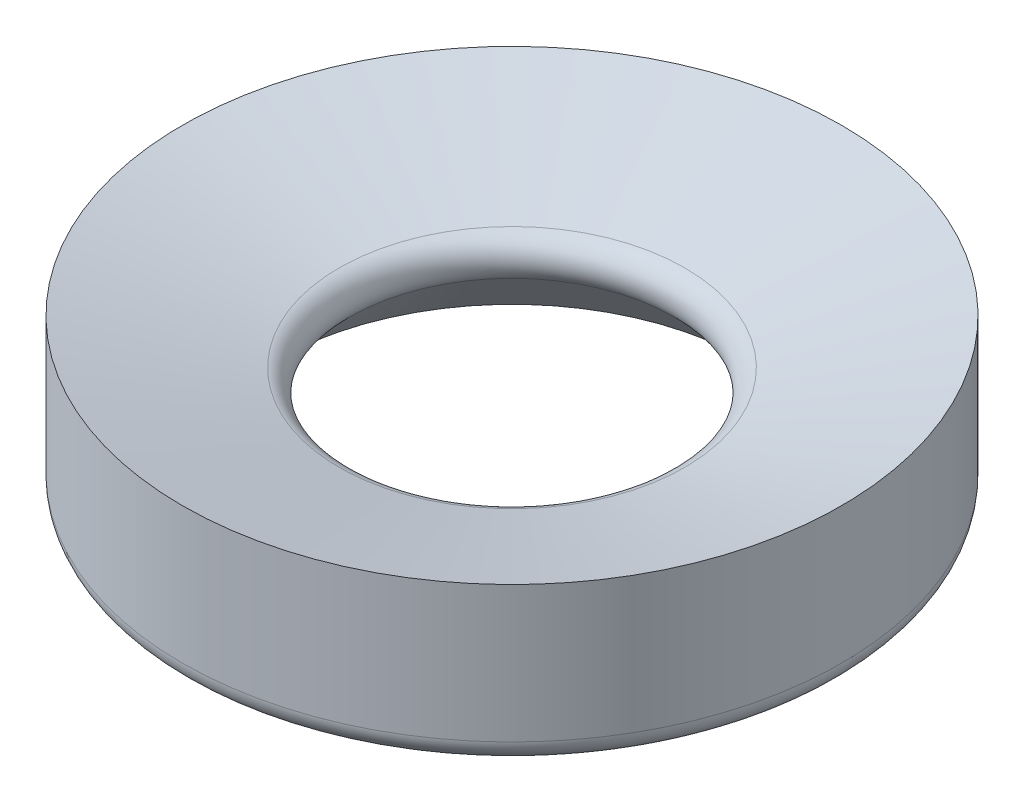
from build123d import *

# Parameters (mm, degrees)
SKETCH1_R           = 36.83
BOSS_EXTRUDE1_DEPTH = 17.78
FILLET1_R           = 2.54
SKETCH2_R           = 26.67
SKETCH3_R           = 14.7955
SKETCH4_R           = 14.7955
CUT_EXTRUDE1_DEPTH  = 76.2
SKETCH7_R           = 14.7955
SKETCH6_R           = 36.83
SKETCH8_R           = 31.75
SKETCH8_R_2         = 29.21
CUT_EXTRUDE2_DEPTH  = 2.54
FILLET3_R           = 2.54
FILLET4_R           = 2.54
FILLET5_R           = 2.54


with BuildPart() as part:
    # Sketch1 → Boss-Extrude1 (new body)
    with BuildSketch(Plane(origin=(0, 0, 0), x_dir=(1, 0, 0), z_dir=(0, 1, 0))):
        with Locations(Location((0, 0, 0), (0, 0, 90))):
            Circle(SKETCH1_R)
    extrude(amount=BOSS_EXTRUDE1_DEPTH)

    # Fillet1
    fillet1_edges = [part.edges().sort_by_distance(p)[0] for p in [
        (0, 0, 36.83),
    ]]
    fillet(fillet1_edges, radius=FILLET1_R)

    # Sketch2 → Cut-Loft1 section 0
    with BuildSketch(Plane(origin=(0, 0, 0), x_dir=(1, 0, 0), z_dir=(0, 1, 0))):
        Circle(SKETCH2_R)
    # Sketch3 → Cut-Loft1 section 1
    with BuildSketch(Plane(origin=(0, 11.938, 0), x_dir=(1, 0, 0), z_dir=(0, 1, 0))):
        Circle(SKETCH3_R)
    loft(mode=Mode.SUBTRACT)

    # Sketch4 → Cut-Extrude1 (cut)
    with BuildSketch(Plane.XZ.offset(-11.938)):
        with Locations(Location((0, 0, 0), (0, 0, 270))):
            Circle(SKETCH4_R)
    extrude(amount=-CUT_EXTRUDE1_DEPTH, mode=Mode.SUBTRACT)

    # Sketch7 → Cut-Loft2 section 0
    with BuildSketch(Plane(origin=(0, 11.43, 0), x_dir=(1, 0, 0), z_dir=(0, 1, 0))):
        Circle(SKETCH7_R)
    # Sketch6 → Cut-Loft2 section 1
    with BuildSketch(Plane(origin=(0, 17.78, 0), x_dir=(1, 0, 0), z_dir=(0, 1, 0))):
        Circle(SKETCH6_R)
    loft(mode=Mode.SUBTRACT)

    # Sketch8 → Cut-Extrude2 (cut)
    with BuildSketch(Plane.XZ):
        with Locations(Location((0, 0, 0), (0, 0, 270))):
            Circle(SKETCH8_R)
        with Locations(Location((0, 0, 0), (0, 0, 270))):
            Circle(SKETCH8_R_2, mode=Mode.SUBTRACT)
    extrude(amount=-CUT_EXTRUDE2_DEPTH, mode=Mode.SUBTRACT)

    # Fillet3
    fillet3_edges = [part.edges().sort_by_distance(p)[0] for p in [
        (0, 0, 31.75),
    ]]
    fillet(fillet3_edges, radius=FILLET3_R - 0.0001)  # a hair under: the kernel refuses the full size

    # Fillet4
    fillet4_edges = [part.edges().sort_by_distance(p)[0] for p in [
        (0, 0, 29.21),
    ]]
    fillet(fillet4_edges, radius=FILLET4_R - 0.0001)  # a hair under: the kernel refuses the full size

    # Fillet5
    fillet5_edges = [part.edges().sort_by_distance(p)[0] for p in [
        (-15.18822317, 11.543176706, 0),
    ]]
    fillet(fillet5_edges, radius=FILLET5_R)


solid = part.part
